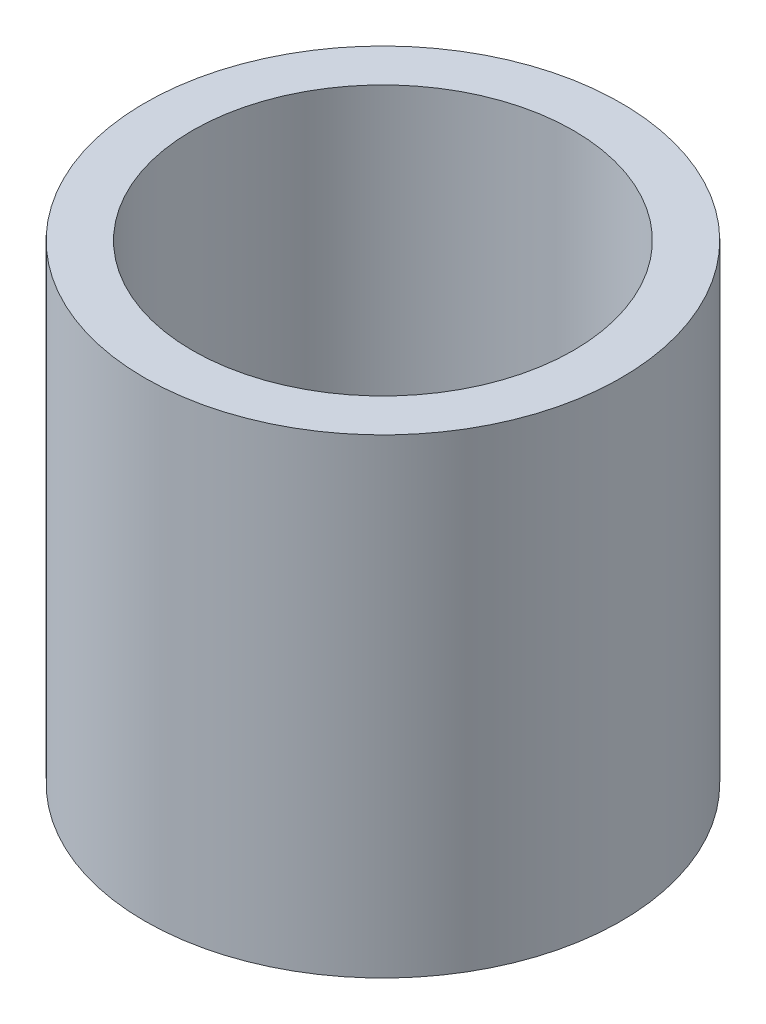
from build123d import *

# Parameters (mm, degrees)
SKETCH1_R           = 10
SKETCH1_R_2         = 8
BOSS_EXTRUDE1_DEPTH = 19.75


with BuildPart() as part:
    # Sketch1 → Boss-Extrude1 (new body)
    with BuildSketch(Plane(origin=(0, 0, 0), x_dir=(1, 0, 0), z_dir=(0, 1, 0))):
        Circle(SKETCH1_R)
        Circle(SKETCH1_R_2, mode=Mode.SUBTRACT)
    extrude(amount=BOSS_EXTRUDE1_DEPTH)


solid = part.part
